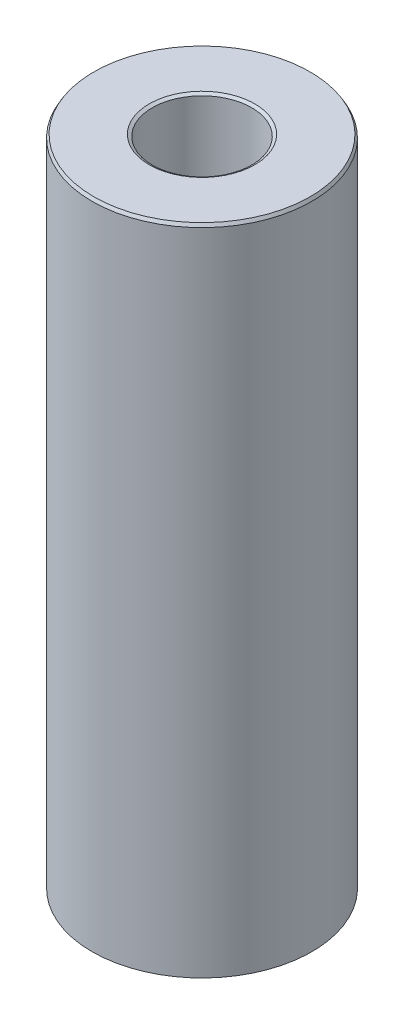
from build123d import *
from OCP.BRepFilletAPI import BRepFilletAPI_MakeChamfer

# Parameters (mm, degrees)
SKETCH1_R           = 12.5
BOSS_EXTRUDE1_DEPTH = 74.4313333
SKETCH2_R           = 5.651616632
CUT_EXTRUDE1_DEPTH  = 77.501786756
CHAMFER1_SIZE       = 0.350094924
CHAMFER1_SIZE2      = 0.202127399


with BuildPart() as part:
    # Sketch1 → Boss-Extrude1 (new body)
    with BuildSketch(Plane(origin=(0, 0, 0), x_dir=(1, 0, 0), z_dir=(0, 1, 0))):
        Circle(SKETCH1_R)
    extrude(amount=BOSS_EXTRUDE1_DEPTH)

    # Sketch2 → Cut-Extrude1 (cut, through all)
    with BuildSketch(Plane(origin=(0, 0, 0), x_dir=(1, 0, 0), z_dir=(0, 1, 0))):
        Circle(SKETCH2_R)
    extrude(amount=CUT_EXTRUDE1_DEPTH, mode=Mode.SUBTRACT)

    # Chamfer1: one chamfer whose edges measure the first distance from different faces: ONE call of the kernel's chamfer builder (chamfer() names one face for all edges)
    chamfer1_edges_1 = [part.edges().sort_by_distance(p)[0] for p in [
        (-5.651616632, 74.4313333, 0),
    ]]
    chamfer1_side_1 = [part.faces().sort_by_distance(p)[0] for p in [
        (-12.146446609, 74.4313333, 0),
    ]]
    chamfer1_edges_2 = [part.edges().sort_by_distance(p)[0] for p in [
        (-5.651616632, 0, 0),
    ]]
    chamfer1_side_2 = [part.faces().sort_by_distance(p)[0] for p in [
        (-5.651616632, 37.21566665, 0),
    ]]
    chamfer1_edges_3 = [part.edges().sort_by_distance(p)[0] for p in [
        (-12.5, 0, 0),
    ]]
    chamfer1_side_3 = [part.faces().sort_by_distance(p)[0] for p in [
        (-12.146446609, 0, 0),
    ]]
    chamfer1_edges_4 = [part.edges().sort_by_distance(p)[0] for p in [
        (-12.5, 74.4313333, 0),
    ]]
    chamfer1_side_4 = [part.faces().sort_by_distance(p)[0] for p in [
        (-12.5, 37.21566665, 0),
    ]]
    chamfer1 = BRepFilletAPI_MakeChamfer(part.part.solid().wrapped)
    for e in chamfer1_edges_1:
        chamfer1.Add(CHAMFER1_SIZE, CHAMFER1_SIZE2, e.wrapped, chamfer1_side_1[0].wrapped)  # the first distance lies on this face
    for e in chamfer1_edges_2:
        chamfer1.Add(CHAMFER1_SIZE, CHAMFER1_SIZE2, e.wrapped, chamfer1_side_2[0].wrapped)  # the first distance lies on this face
    for e in chamfer1_edges_3:
        chamfer1.Add(CHAMFER1_SIZE, CHAMFER1_SIZE2, e.wrapped, chamfer1_side_3[0].wrapped)  # the first distance lies on this face
    for e in chamfer1_edges_4:
        chamfer1.Add(CHAMFER1_SIZE, CHAMFER1_SIZE2, e.wrapped, chamfer1_side_4[0].wrapped)  # the first distance lies on this face
    add(Compound.cast(chamfer1.Shape()), mode=Mode.REPLACE)


solid = part.part
